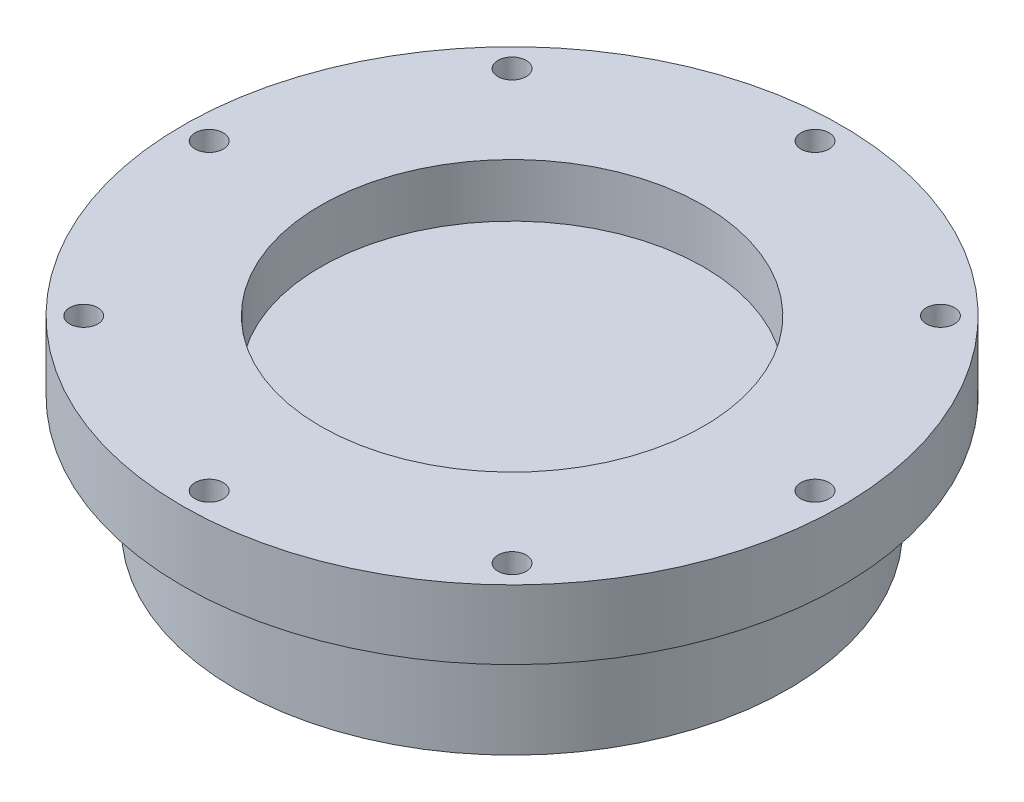
from build123d import *

# Parameters (mm, degrees)
SKETCH1_R           = 55.88
BOSS_EXTRUDE1_DEPTH = 23.495
SKETCH2_R           = 66.675
BOSS_EXTRUDE2_DEPTH = 13.97
FILLET1_R           = 7.62
SKETCH3_R           = 2.8575
CUT_EXTRUDE1_DEPTH  = 102.462985739
CIRPATTERN1_COUNT   = 8
SKETCH4_R           = 38.735
CUT_EXTRUDE2_DEPTH  = 10.795


with BuildPart() as part:
    # Sketch1 → Boss-Extrude1 (new body)
    with BuildSketch(Plane(origin=(0, 0, 0), x_dir=(1, 0, 0), z_dir=(0, 1, 0))):
        Circle(SKETCH1_R)
    extrude(amount=BOSS_EXTRUDE1_DEPTH)

    # Sketch2 → Boss-Extrude2 (add)
    with BuildSketch(Plane(origin=(0, 23.495, 0), x_dir=(1, 0, 0), z_dir=(0, 1, 0))):
        Circle(SKETCH2_R)
    extrude(amount=BOSS_EXTRUDE2_DEPTH)

    # Fillet1
    fillet1_edges = [part.edges().sort_by_distance(p)[0] for p in [
        (-55.88, 23.495, 0),
    ]]
    fillet(fillet1_edges, radius=FILLET1_R)

    # Sketch3 → Cut-Extrude1 (cut, through all)
    with BuildSketch(Plane(origin=(0, 37.465, 0), x_dir=(1, 0, 0), z_dir=(0, 1, 0))):
        with Locations((0, 61.2775)):
            Circle(SKETCH3_R)
    cut_extrude1 = extrude(amount=-CUT_EXTRUDE1_DEPTH, mode=Mode.SUBTRACT)

    # CirPattern1: Cut-Extrude1 ×8 about axis
    cirpattern1_axis = Axis((0, 37.465, 0), (0, 1, 0))
    for i in range(1, CIRPATTERN1_COUNT):
        add(cut_extrude1.rotate(cirpattern1_axis, i * 360 / CIRPATTERN1_COUNT), mode=Mode.SUBTRACT)

    # Sketch4 → Cut-Extrude2 (cut)
    with BuildSketch(Plane(origin=(0, 37.465, 0), x_dir=(1, 0, 0), z_dir=(0, 1, 0))):
        Circle(SKETCH4_R)
    extrude(amount=-CUT_EXTRUDE2_DEPTH, mode=Mode.SUBTRACT)


solid = part.part
